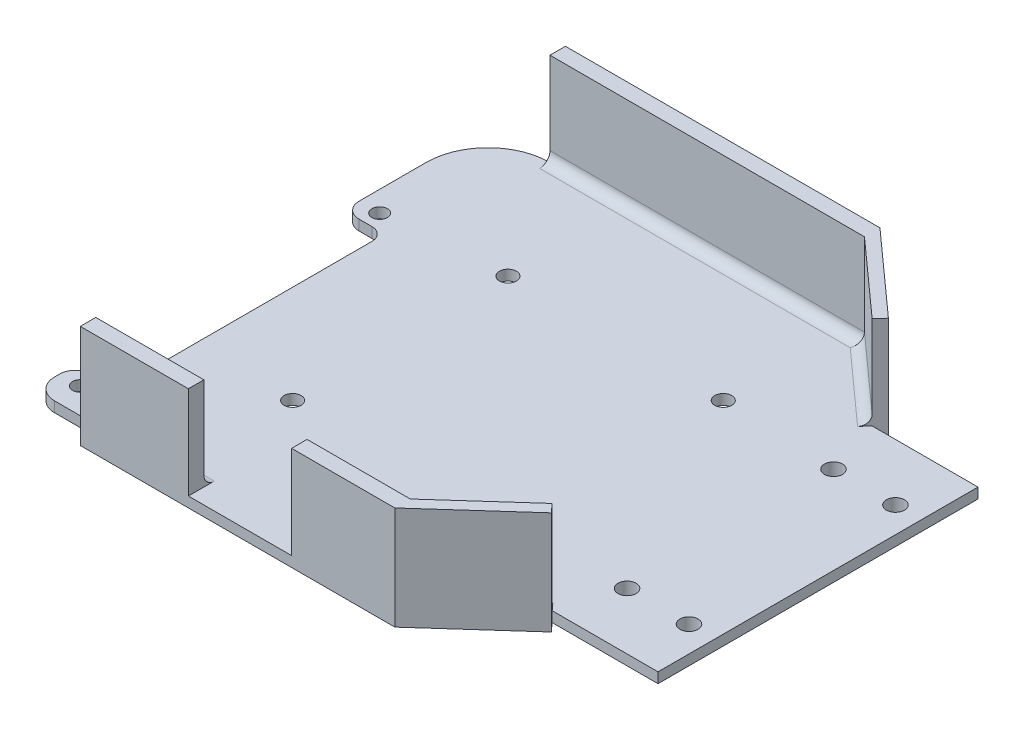
from build123d import *

# Parameters (mm, degrees)
CROQUIS1_R              = 1.5
CROQUIS1_R_2            = 1.65
SALIENTE_EXTRUIR1_DEPTH = 2
REDONDEO1_R             = 4
CORTAR_EXTRUIR1_DEPTH   = 77.372514035
REDONDEO2_R             = 3
CROQUIS5_R              = 1.75
CORTAR_EXTRUIR2_DEPTH   = 77.372514035
CROQUIS6_R              = 2.75
CROQUIS6_R_2            = 1.75
SALIENTE_EXTRUIR6_DEPTH = 2
SALIENTE_EXTRUIR7_DEPTH = 20
CORTAR_EXTRUIR3_REACH   = 112.221
CROQUIS8_W              = 20
CROQUIS8_H              = 18
REDONDEO3_R             = 2


with BuildPart() as part:
    # Croquis1 → Saliente-Extruir1 (new body)
    with BuildSketch(Plane(origin=(0, 0, 0), x_dir=(1, 0, 0), z_dir=(0, 1, 0))):
        with BuildLine():
            Line((33.46, 41), (18.97, 54))
            Line((18.97, 54), (-41.97, 54))
            ThreePointArc((-41.97, 54), (-50.455281374, 50.485281374), (-53.97, 42))
            Line((-53.97, 42), (-53.97, -34))
            Line((-53.97, -34), (18.97, -34))
            Line((18.97, -34), (33.46, -21))
            Line((33.46, -21), (53.97, -21))
            Line((53.97, -21), (53.97, 7.59309581))
            Line((53.97, 7.59309581), (53.97, 12.40690419))
            Line((53.97, 12.40690419), (53.97, 41))
            Line((53.97, 41), (33.46, 41))
        make_face()
        with Locations(Location((-49.97, -29, 0), (0, 0, 270))):
            Circle(CROQUIS1_R, mode=Mode.SUBTRACT)
        with Locations(Location((-26.97, -10.86, 0), (0, 0, 270))):
            Circle(CROQUIS1_R_2, mode=Mode.SUBTRACT)
        with Locations(Location((14.75, -10.86, 0), (0, 0, 270))):
            Circle(CROQUIS1_R_2, mode=Mode.SUBTRACT)
        with Locations(Location((-49.97, 29, 0), (0, 0, 270))):
            Circle(CROQUIS1_R, mode=Mode.SUBTRACT)
        with Locations(Location((-26.97, 30.86, 0), (0, 0, 270))):
            Circle(CROQUIS1_R_2, mode=Mode.SUBTRACT)
        with Locations(Location((14.75, 30.86, 0), (0, 0, 270))):
            Circle(CROQUIS1_R_2, mode=Mode.SUBTRACT)
    extrude(amount=SALIENTE_EXTRUIR1_DEPTH)

    # Redondeo1
    redondeo1_edges = [part.edges().sort_by_distance(p)[0] for p in [
        (-53.97, 1, 34),
    ]]
    fillet(redondeo1_edges, radius=REDONDEO1_R)

    # Croquis4 → Cortar-Extruir1 (cut, through all)
    with BuildSketch(Plane(origin=(0, 2, 0), x_dir=(1, 0, 0), z_dir=(0, 1, 0))):
        with BuildLine():
            Line((-53.97, 26), (-53.97, -26))
            Line((-53.97, -26), (-48.47, -26))
            ThreePointArc((-48.47, -26), (-46.702233047, -25.267766953), (-45.97, -23.5))
            Line((-45.97, -23.5), (-45.97, 23.5))
            ThreePointArc((-45.97, 23.5), (-46.702233047, 25.267766953), (-48.47, 26))
            Line((-48.47, 26), (-53.97, 26))
        make_face()
    extrude(amount=-CORTAR_EXTRUIR1_DEPTH, mode=Mode.SUBTRACT)

    # Redondeo2
    redondeo2_edges = [part.edges().sort_by_distance(p)[0] for p in [
        (-53.97, 1, -26),
        (-53.97, 1, 26),
    ]]
    fillet(redondeo2_edges, radius=REDONDEO2_R)

    # Croquis5 → Cortar-Extruir2 (cut, through all)
    with BuildSketch(Plane(origin=(0, 2, 0), x_dir=(1, 0, 0), z_dir=(0, 1, 0))):
        with Locations(Location((36.97, 30, 0), (0, 0, 270))):
            Circle(CROQUIS5_R)
        with Locations(Location((36.97, -10, 0), (0, 0, 270))):
            Circle(CROQUIS5_R)
        with Locations(Location((48.97, 30, 0), (0, 0, 270))):
            Circle(CROQUIS5_R)
        with Locations(Location((48.97, -10, 0), (0, 0, 270))):
            Circle(CROQUIS5_R)
    extrude(amount=-CORTAR_EXTRUIR2_DEPTH, mode=Mode.SUBTRACT)

    # Croquis6 → Saliente-Extruir6 (add)
    # profile 1 of 4: a face of its own
    with BuildSketch(Plane.XZ):
        with Locations(Location((36.97, 10, 0), (0, 0, 270))):
            Circle(CROQUIS6_R)
        with Locations(Location((36.97, 10, 0), (0, 0, 90))):
            Circle(CROQUIS6_R_2, mode=Mode.SUBTRACT)
    # profile 2 of 4: a face of its own
    with BuildSketch(Plane.XZ):
        with Locations(Location((36.97, -30, 0), (0, 0, 270))):
            Circle(CROQUIS6_R)
        with Locations(Location((36.97, -30, 0), (0, 0, 90))):
            Circle(CROQUIS6_R_2, mode=Mode.SUBTRACT)
    # profile 3 of 4: a face of its own
    with BuildSketch(Plane.XZ):
        with Locations(Location((48.97, -30, 0), (0, 0, 270))):
            Circle(CROQUIS6_R)
        with Locations(Location((48.97, -30, 0), (0, 0, 90))):
            Circle(CROQUIS6_R_2, mode=Mode.SUBTRACT)
    # profile 4 of 4: a face of its own
    with BuildSketch(Plane.XZ):
        with Locations(Location((48.97, 10, 0), (0, 0, 270))):
            Circle(CROQUIS6_R)
        with Locations(Location((48.97, 10, 0), (0, 0, 90))):
            Circle(CROQUIS6_R_2, mode=Mode.SUBTRACT)
    extrude(amount=SALIENTE_EXTRUIR6_DEPTH)

    # Croquis7 → Saliente-Extruir7 (add)
    with BuildSketch(Plane(origin=(0, 0, 0), x_dir=(1, 0, 0), z_dir=(0, 1, 0))):
        Polygon((-41.97, -34), (18.97, -34), (33.46, -21), (34.951212399, -22.662128282), (18.97, -37), (-41.97, -37), align=None)
        Polygon((-41.97, 54), (18.97, 54), (33.46, 41), (34.951212399, 42.662128282), (18.97, 57), (-41.97, 57), align=None)
    extrude(amount=SALIENTE_EXTRUIR7_DEPTH)

    # Croquis8 → Cortar-Extruir3 (cut, up to next)
    with BuildSketch(Plane.XY.offset(37), mode=Mode.PRIVATE) as cortar_extruir3_sk1:
        with Locations((-11.03, 11)):
            Rectangle(CROQUIS8_W, CROQUIS8_H)
    cortar_extruir3_tool1 = extrude(cortar_extruir3_sk1.sketch, amount=-CORTAR_EXTRUIR3_REACH, mode=Mode.PRIVATE) & part.part
    add(cortar_extruir3_tool1.solids().sort_by_distance((-11.03, 11, 37))[0], mode=Mode.SUBTRACT)

    # Redondeo3
    # the kernel refuses this fillet: 2 mm, written as the material it adds along each edge
    with BuildSketch(Plane(origin=(-41.97, 2, 34), x_dir=(0, 0, -1), z_dir=(1, 0, 0))) as redondeo3_piece_1:
        with BuildLine():
            CenterArc((REDONDEO3_R, REDONDEO3_R), REDONDEO3_R, 180, 90)
            Line((0, REDONDEO3_R), (0, 0))
            Line((0, 0), (REDONDEO3_R, 0))
        make_face()
    extrude(amount=20.94)
    with BuildSketch(Plane(origin=(-1.03, 2, 34), x_dir=(0, 0, -1), z_dir=(1, 0, 0))) as redondeo3_piece_2_section:
        with BuildLine():
            CenterArc((REDONDEO3_R, REDONDEO3_R), REDONDEO3_R, 180, 90)
            Line((0, REDONDEO3_R), (0, 0))
            Line((0, 0), (REDONDEO3_R, 0))
        make_face()
    redondeo3_piece_2 = extrude(amount=25, mode=Mode.PRIVATE)
    redondeo3_piece_2 = split(redondeo3_piece_2, bisect_by=Plane(origin=(13.795733926, 2.442237096, 38.642198686), z_dir=(-0.6678002989650054, 0, -0.7443404870771505)), keep=Keep.TOP, mode=Mode.PRIVATE)
    add(redondeo3_piece_2)
    with BuildSketch(Plane(origin=(23.97, 2, -54), x_dir=(0, 0, 1), z_dir=(-1, 0, 0))) as redondeo3_piece_3_section:
        with BuildLine():
            CenterArc((REDONDEO3_R, REDONDEO3_R), REDONDEO3_R, 180, 90)
            Line((0, REDONDEO3_R), (0, 0))
            Line((0, 0), (REDONDEO3_R, 0))
        make_face()
    redondeo3_piece_3 = extrude(amount=65.94, mode=Mode.PRIVATE)
    redondeo3_piece_3 = split(redondeo3_piece_3, bisect_by=Plane(origin=(3.244998738, 2.450659897, -68.108006653), z_dir=(-0.6678002989650061, 0, 0.7443404870771497)), keep=Keep.TOP, mode=Mode.PRIVATE)
    add(redondeo3_piece_3)
    with BuildSketch(Plane(origin=(15.248297565, 2, 37.339001495), x_dir=(-0.6678002989650055, 0, -0.7443404870771503), z_dir=(0.7443404870771504, 0, -0.6678002989650055))) as redondeo3_piece_4_section:
        with BuildLine():
            CenterArc((REDONDEO3_R, REDONDEO3_R), REDONDEO3_R, 180, 90)
            Line((0, REDONDEO3_R), (0, 0))
            Line((0, 0), (REDONDEO3_R, 0))
        make_face()
    redondeo3_piece_4 = extrude(amount=24.466897544, mode=Mode.PRIVATE)
    redondeo3_piece_4 = split(redondeo3_piece_4, bisect_by=Plane(origin=(25.546033726, 2.446735878, 34), z_dir=(0, 0, -1)), keep=Keep.TOP, mode=Mode.PRIVATE)
    add(redondeo3_piece_4)
    with BuildSketch(Plane(origin=(33.46, 2, -41), x_dir=(-0.6678002989650058, 0, 0.74434048707715), z_dir=(-0.7443404870771501, 0, -0.6678002989650059))) as redondeo3_piece_5_section:
        with BuildLine():
            CenterArc((REDONDEO3_R, REDONDEO3_R), REDONDEO3_R, 180, 90)
            Line((0, REDONDEO3_R), (0, 0))
            Line((0, 0), (REDONDEO3_R, 0))
        make_face()
    redondeo3_piece_5 = extrude(amount=24.466897544, mode=Mode.PRIVATE)
    redondeo3_piece_5 = split(redondeo3_piece_5, bisect_by=Plane(origin=(32.635535298, 2.26154088, -54), z_dir=(0, 0, 1)), keep=Keep.TOP, mode=Mode.PRIVATE)
    add(redondeo3_piece_5)


solid = part.part
